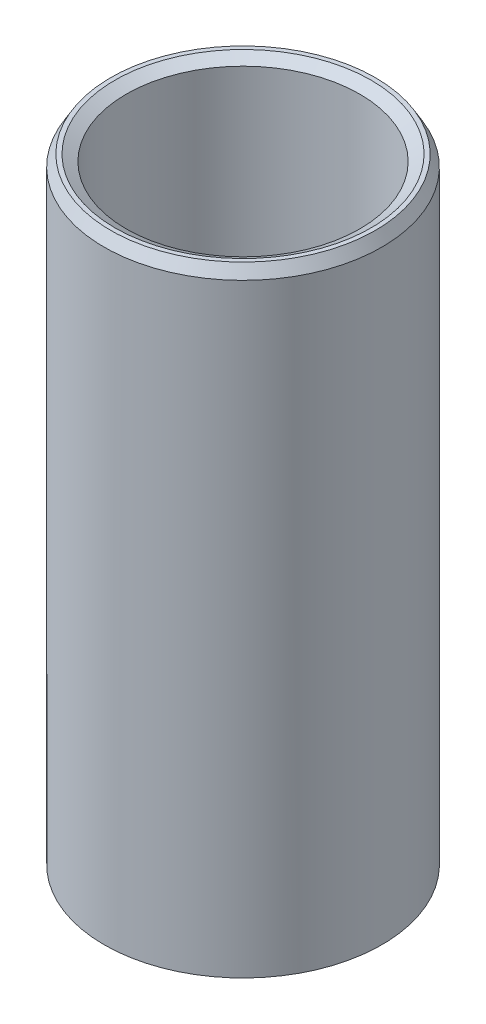
from build123d import *
from OCP.BRepFilletAPI import BRepFilletAPI_MakeChamfer

# Parameters (mm, degrees)
SKETCH1_R           = 47.5
BOSS_EXTRUDE1_DEPTH = 212.741151074
SKETCH2_R           = 39.947484703
CUT_EXTRUDE1_DEPTH  = 224.094816973
CHAMFER1_SIZE       = 3.849332209
CHAMFER1_SIZE2      = 2.222412987


with BuildPart() as part:
    # Sketch1 → Boss-Extrude1 (new body)
    with BuildSketch(Plane(origin=(0, 0, 0), x_dir=(1, 0, 0), z_dir=(0, 1, 0))):
        Circle(SKETCH1_R)
    extrude(amount=BOSS_EXTRUDE1_DEPTH)

    # Sketch2 → Cut-Extrude1 (cut, through all)
    with BuildSketch(Plane(origin=(0, 0, 0), x_dir=(1, 0, 0), z_dir=(0, 1, 0))):
        Circle(SKETCH2_R)
    extrude(amount=CUT_EXTRUDE1_DEPTH, mode=Mode.SUBTRACT)

    # Chamfer1: one chamfer whose edges measure the first distance from different faces: ONE call of the kernel's chamfer builder (chamfer() names one face for all edges)
    chamfer1_edges_1 = [part.edges().sort_by_distance(p)[0] for p in [
        (-39.947484703, 212.741151074, 0),
    ]]
    chamfer1_side_1 = [part.faces().sort_by_distance(p)[0] for p in [
        (-46.156497116, 212.741151074, 0),
    ]]
    chamfer1_edges_2 = [part.edges().sort_by_distance(p)[0] for p in [
        (-39.947484703, 0, 0),
    ]]
    chamfer1_side_2 = [part.faces().sort_by_distance(p)[0] for p in [
        (-39.947484703, 106.370575537, 0),
    ]]
    chamfer1_edges_3 = [part.edges().sort_by_distance(p)[0] for p in [
        (-47.5, 0, 0),
    ]]
    chamfer1_side_3 = [part.faces().sort_by_distance(p)[0] for p in [
        (-46.156497116, 0, 0),
    ]]
    chamfer1_edges_4 = [part.edges().sort_by_distance(p)[0] for p in [
        (-47.5, 212.741151074, 0),
    ]]
    chamfer1_side_4 = [part.faces().sort_by_distance(p)[0] for p in [
        (-47.5, 106.370575537, 0),
    ]]
    chamfer1 = BRepFilletAPI_MakeChamfer(part.part.solid().wrapped)
    for e in chamfer1_edges_1:
        chamfer1.Add(CHAMFER1_SIZE, CHAMFER1_SIZE2, e.wrapped, chamfer1_side_1[0].wrapped)  # the first distance lies on this face
    for e in chamfer1_edges_2:
        chamfer1.Add(CHAMFER1_SIZE, CHAMFER1_SIZE2, e.wrapped, chamfer1_side_2[0].wrapped)  # the first distance lies on this face
    for e in chamfer1_edges_3:
        chamfer1.Add(CHAMFER1_SIZE, CHAMFER1_SIZE2, e.wrapped, chamfer1_side_3[0].wrapped)  # the first distance lies on this face
    for e in chamfer1_edges_4:
        chamfer1.Add(CHAMFER1_SIZE, CHAMFER1_SIZE2, e.wrapped, chamfer1_side_4[0].wrapped)  # the first distance lies on this face
    add(Compound.cast(chamfer1.Shape()), mode=Mode.REPLACE)


solid = part.part
